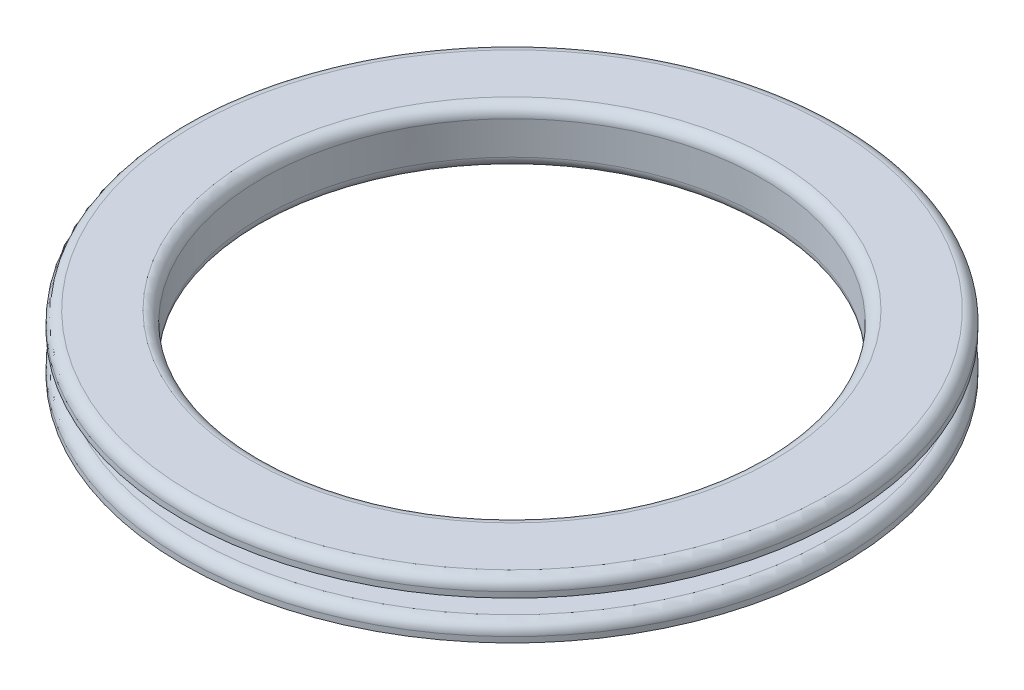
from build123d import *

# Parameters (mm, degrees)
FILLET1_R = 0.4


with BuildPart() as part:
    # Sketch1 → Revolve1 (revolve)
    with BuildSketch(Plane.XY, mode=Mode.PRIVATE) as revolve1_sk:
        Polygon((-9, 0), (-9, 2), (-11.87175241, 2), (-11.87175241, 1.4), (-10.153413472, 1.4), (-10.153413472, 0.6), (-11.87175241, 0.6), (-11.87175241, 0), align=None)
    revolve(revolve1_sk.sketch.rotate(Axis((0, 7.246866229, 0), (0, -1, 0)), 270), axis=Axis((0, 7.246866229, 0), (0, -1, 0)))

    # Fillet1
    fillet1_edges = [part.edges().sort_by_distance(p)[0] for p in [
        (0, 0.6, -11.87175241),
        (0, 0.6, -10.153413472),
        (0, 1.4, -10.153413472),
        (0, 2, -11.87175241),
        (0, 2, -9),
        (0, 0, -9),
    ]]
    fillet(fillet1_edges, radius=FILLET1_R - 0.0001)  # a hair under: the kernel refuses the full size


solid = part.part
